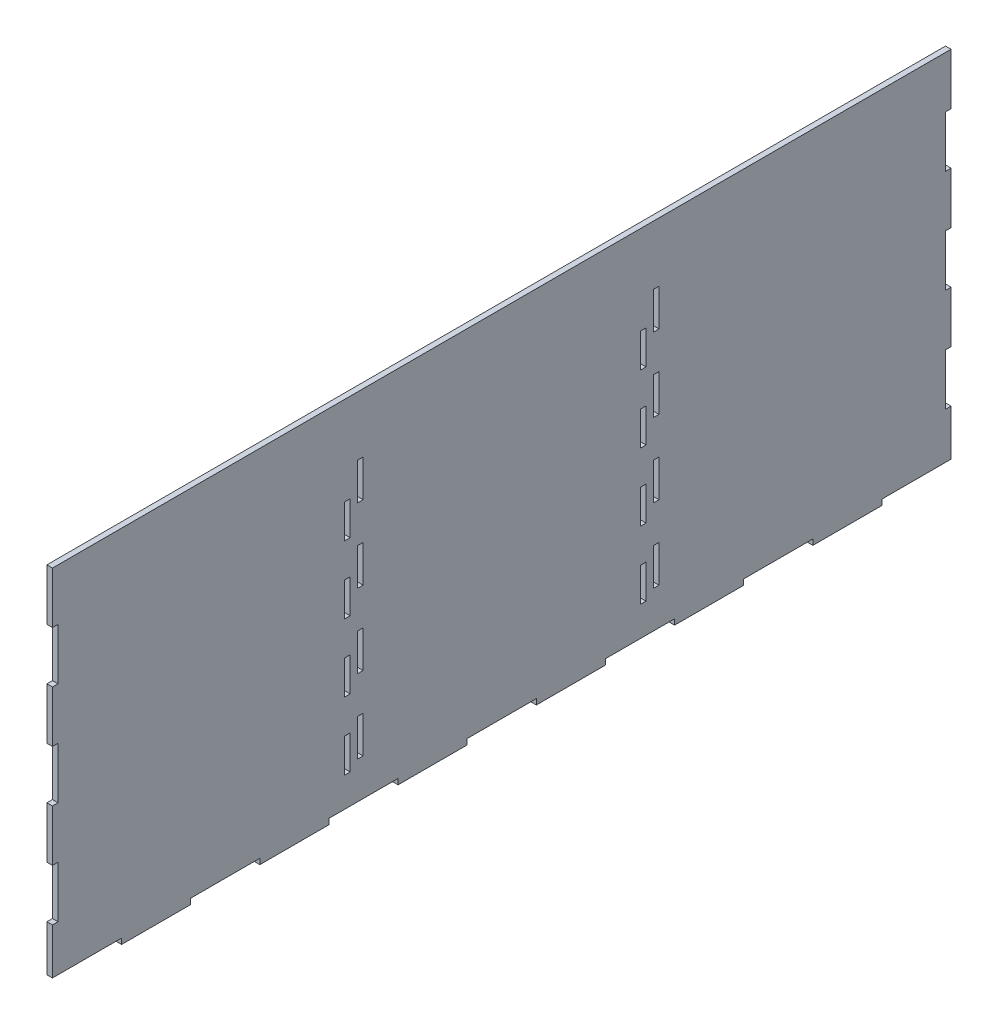
from build123d import *

# Parameters (mm, degrees)
BOSS_EXTRUDE1_DEPTH = 4.7625
SKETCH3_W           = 4.7625
SKETCH3_H           = 29.028571429
SKETCH3_H_2         = 31.75
CUT_EXTRUDE1_DEPTH  = 417.575850499


with BuildPart() as part:
    # Sketch1 → Boss-Extrude1 (new body)
    with BuildSketch(Plane(origin=(0, 0, 0), x_dir=(0, 0, -1), z_dir=(1, 0, 0))):
        Polygon((-385.7625, 152.4), (-385.7625, 108.176785714), (-381, 108.176785714), (-381, 63.953571429), (-385.7625, 63.953571429), (-385.7625, 19.730357143), (-381, 19.730357143), (-381, -24.492857143), (-385.7625, -24.492857143), (-385.7625, -68.716071429), (-381, -68.716071429), (-381, -112.939285714), (-385.7625, -112.939285714), (-385.7625, -152.4), (-326.414423077, -152.4), (-326.414423077, -157.1625), (-267.066346154, -157.1625), (-267.066346154, -152.4), (-207.718269231, -152.4), (-207.718269231, -157.1625), (-148.370192308, -157.1625), (-148.370192308, -152.4), (-89.022115385, -152.4), (-89.022115385, -157.1625), (-29.674038462, -157.1625), (-29.674038462, -152.4), (29.674038462, -152.4), (29.674038462, -157.1625), (89.022115385, -157.1625), (89.022115385, -152.4), (148.370192308, -152.4), (148.370192308, -157.1625), (207.718269231, -157.1625), (207.718269231, -152.4), (267.066346154, -152.4), (267.066346154, -157.1625), (326.414423077, -157.1625), (326.414423077, -152.4), (385.7625, -152.4), (385.7625, -112.939285714), (381, -112.939285714), (381, -68.716071429), (385.7625, -68.716071429), (385.7625, -24.492857143), (381, -24.492857143), (381, 19.730357143), (385.7625, 19.730357143), (385.7625, 63.953571429), (381, 63.953571429), (381, 108.176785714), (385.7625, 108.176785714), (385.7625, 152.4), align=None)
    extrude(amount=BOSS_EXTRUDE1_DEPTH)

    # Sketch3 → Cut-Extrude1 (cut, through all)
    with BuildSketch(Plane(origin=(4.7625, 0, 0), x_dir=(0, 0, -1), z_dir=(1, 0, 0))):
        with Locations((-132.55625, 61.685714285)):
            Rectangle(SKETCH3_W, SKETCH3_H)
        with Locations((-132.55625, 3.628571428)):
            Rectangle(SKETCH3_W, SKETCH3_H)
        with Locations((-132.55625, -54.428571428)):
            Rectangle(SKETCH3_W, SKETCH3_H)
        with Locations((-132.55625, -112.485714286)):
            Rectangle(SKETCH3_W, SKETCH3_H)
        with Locations((-121.44375, 85.725)):
            Rectangle(SKETCH3_W, SKETCH3_H_2)
        with Locations((-121.44375, 22.225)):
            Rectangle(SKETCH3_W, SKETCH3_H_2)
        with Locations((-121.44375, -41.275)):
            Rectangle(SKETCH3_W, SKETCH3_H_2)
        with Locations((-121.44375, -104.775)):
            Rectangle(SKETCH3_W, SKETCH3_H_2)
        with Locations((121.44375, 61.685714285)):
            Rectangle(SKETCH3_W, SKETCH3_H)
        with Locations((121.44375, 3.628571428)):
            Rectangle(SKETCH3_W, SKETCH3_H)
        with Locations((121.44375, -54.428571428)):
            Rectangle(SKETCH3_W, SKETCH3_H)
        with Locations((121.44375, -112.485714286)):
            Rectangle(SKETCH3_W, SKETCH3_H)
        with Locations((132.55625, 85.725)):
            Rectangle(SKETCH3_W, SKETCH3_H_2)
        with Locations((132.55625, 22.225)):
            Rectangle(SKETCH3_W, SKETCH3_H_2)
        with Locations((132.55625, -41.275)):
            Rectangle(SKETCH3_W, SKETCH3_H_2)
        with Locations((132.55625, -104.775)):
            Rectangle(SKETCH3_W, SKETCH3_H_2)
    extrude(amount=-CUT_EXTRUDE1_DEPTH, mode=Mode.SUBTRACT)


solid = part.part
